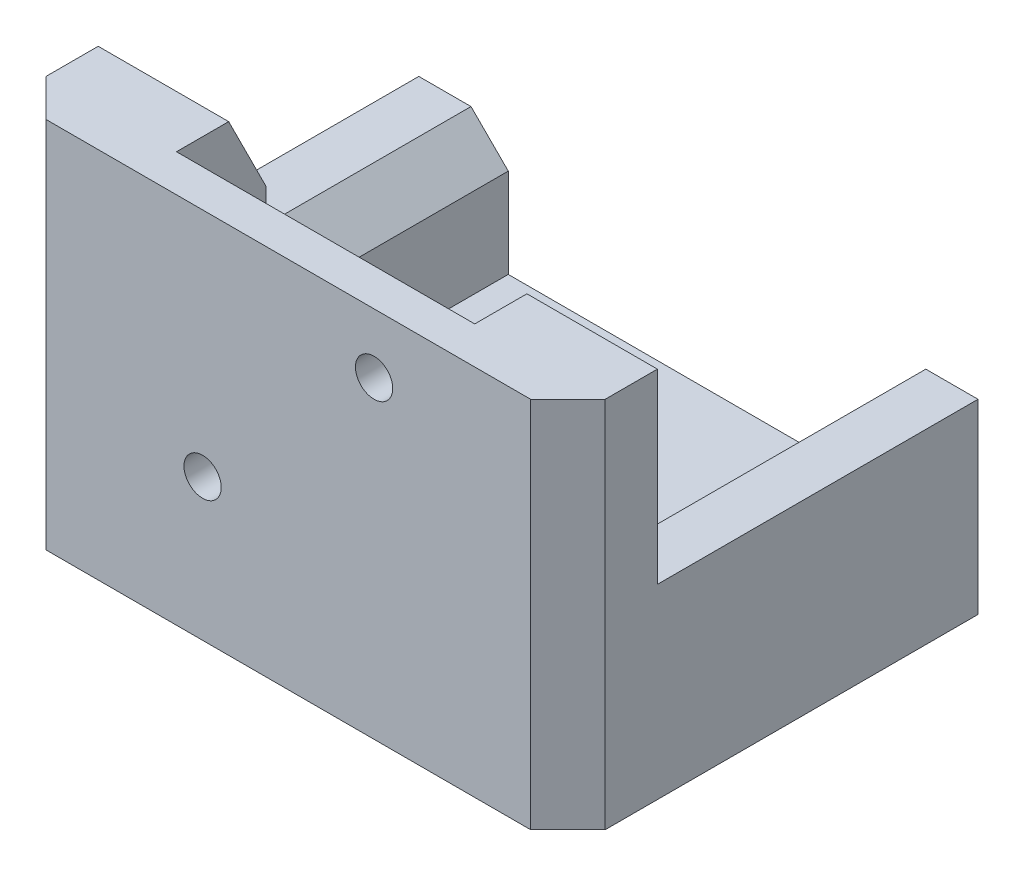
from build123d import *
from OCP.BRepFilletAPI import BRepFilletAPI_MakeChamfer

# Parameters (mm, degrees)
SKETCH1_W           = 75
SKETCH1_H           = 17
BOSS_EXTRUDE1_DEPTH = 50
SKETCH2_W           = 12
SKETCH2_H           = 25
BOSS_EXTRUDE2_DEPTH = 38
SKETCH3_W           = 75
SKETCH3_H           = 55
BOSS_EXTRUDE3_DEPTH = 8
SKETCH4_R           = 2.5
CUT_EXTRUDE1_DEPTH  = 10
SKETCH5_W           = 40
SKETCH5_H           = 42
CUT_EXTRUDE2_DEPTH  = 12
CUT_EXTRUDE3_DEPTH  = 104.07764064
CHAMFER1_SIZE       = 5
CHAMFER3_SIZE       = 5
CHAMFER3_SIZE_2     = 10
CHAMFER4_SIZE       = 5
CHAMFER4_SIZE2      = 10


with BuildPart() as part:
    # Sketch1 → Boss-Extrude1 (new body)
    with BuildSketch(Plane(origin=(0, 0, 0), x_dir=(1, 0, 0), z_dir=(0, 1, 0))):
        with Locations((37.5, 8.5)):
            Rectangle(SKETCH1_W, SKETCH1_H)
    extrude(amount=BOSS_EXTRUDE1_DEPTH)

    # Sketch2 → Boss-Extrude2 (add)
    with BuildSketch(Plane(origin=(0, 0, -17), x_dir=(-1, 0, 0), z_dir=(0, 0, -1))):
        with Locations((-69, 12.5)):
            Rectangle(SKETCH2_W, SKETCH2_H)
        with Locations((-6, 12.5)):
            Rectangle(SKETCH2_W, SKETCH2_H)
    extrude(amount=BOSS_EXTRUDE2_DEPTH)

    # Sketch3 → Boss-Extrude3 (add)
    with BuildSketch(Plane.XZ):
        with Locations((37.5, -27.5)):
            Rectangle(SKETCH3_W, SKETCH3_H)
    extrude(amount=-BOSS_EXTRUDE3_DEPTH)

    # Sketch4 → Cut-Extrude1 (cut)
    with BuildSketch(Plane(origin=(0, 0, 0), x_dir=(-1, 0, 0), z_dir=(0, -1, 0))):
        with Locations(Location((-6.5, 8, 0), (0, 0, 90))):
            Circle(SKETCH4_R)
        with Locations(Location((-68.5, 8, 0), (0, 0, 90))):
            Circle(SKETCH4_R)
        with Locations(Location((-6.5, 42, 0), (0, 0, 90))):
            Circle(SKETCH4_R)
        with Locations(Location((-68.5, 42, 0), (0, 0, 90))):
            Circle(SKETCH4_R)
    extrude(amount=-CUT_EXTRUDE1_DEPTH, mode=Mode.SUBTRACT)

    # Sketch5 → Cut-Extrude2 (cut)
    with BuildSketch(Plane(origin=(0, 0, -17), x_dir=(-1, 0, 0), z_dir=(0, 0, -1))):
        with Locations((-37.5, 29)):
            Rectangle(SKETCH5_W, SKETCH5_H)
    extrude(amount=-CUT_EXTRUDE2_DEPTH, mode=Mode.SUBTRACT)

    # Sketch6 → Cut-Extrude3 (cut, through all)
    with BuildSketch(Plane(origin=(0, 0, -5), x_dir=(-1, 0, 0), z_dir=(0, 0, -1))):
        with BuildLine():
            Line((-49, 39.5), (-49, 42))
            Line((-49, 42), (-46.5, 42))
            ThreePointArc((-46.5, 42), (-50.767766953, 43.767766953), (-49, 39.5))
        make_face()
        with BuildLine():
            Line((-46.5, 42), (-49, 42))
            Line((-49, 42), (-49, 39.5))
            ThreePointArc((-49, 39.5), (-47.232233047, 40.232233047), (-46.5, 42))
        make_face()
        with BuildLine():
            ThreePointArc((-23.5, 19), (-24.232233047, 20.767766953), (-26, 21.5))
            Line((-26, 21.5), (-26, 19))
            Line((-26, 19), (-28.5, 19))
            ThreePointArc((-28.5, 19), (-26, 16.5), (-23.5, 19))
        make_face()
        with BuildLine():
            Line((-26, 19), (-26, 21.5))
            ThreePointArc((-26, 21.5), (-27.767766953, 20.767766953), (-28.5, 19))
            Line((-28.5, 19), (-26, 19))
        make_face()
    extrude(amount=-CUT_EXTRUDE3_DEPTH, mode=Mode.SUBTRACT)

    # Chamfer1
    chamfer1_edges = [part.edges().sort_by_distance(p)[0] for p in [
        (63, 25, -36),
        (12, 25, -36),
        (75, 25, 0),
        (0, 25, 0),
    ]]
    chamfer(chamfer1_edges, length=CHAMFER1_SIZE)

    # Chamfer3
    chamfer3_edges_1 = [part.edges().sort_by_distance(p)[0] for p in [
        (0, 37.5, -17),
    ]]
    chamfer3_side_1 = [part.faces().sort_by_distance(p)[0] for p in [
        (0, 37.5, -16.9),
    ]]
    chamfer3_edges_2 = [part.edges().sort_by_distance(p)[0] for p in [
        (8.75, 50, -17),
    ]]
    chamfer3_side_2 = [part.faces().sort_by_distance(p)[0] for p in [
        (8.75, 50, -16.9),
    ]]
    chamfer3 = BRepFilletAPI_MakeChamfer(part.part.solid().wrapped)
    for e in chamfer3_edges_1:
        chamfer3.Add(CHAMFER3_SIZE - 0.0001, CHAMFER3_SIZE_2 - 0.0001, e.wrapped, chamfer3_side_1[0].wrapped)
    for e in chamfer3_edges_2:
        chamfer3.Add(CHAMFER3_SIZE - 0.0001, CHAMFER3_SIZE_2 - 0.0001, e.wrapped, chamfer3_side_2[0].wrapped)
    add(Compound.cast(chamfer3.Shape()), mode=Mode.REPLACE)  # a hair under: the kernel refuses the full size

    # Chamfer4: one chamfer whose edges measure the first distance from different faces: ONE call of the kernel's chamfer builder (chamfer() names one face for all edges)
    chamfer4_edges_1 = [part.edges().sort_by_distance(p)[0] for p in [
        (66.25, 50, -17),
    ]]
    chamfer4_side_1 = [part.faces().sort_by_distance(p)[0] for p in [
        (0.769025357, 50, -8.50005),
    ]]
    chamfer4_edges_2 = [part.edges().sort_by_distance(p)[0] for p in [
        (75, 37.5, -17),
    ]]
    chamfer4_side_2 = [part.faces().sort_by_distance(p)[0] for p in [
        (75, 17.338709677, -26.322580645),
    ]]
    chamfer4 = BRepFilletAPI_MakeChamfer(part.part.solid().wrapped)
    for e in chamfer4_edges_1:
        chamfer4.Add(CHAMFER4_SIZE, CHAMFER4_SIZE2, e.wrapped, chamfer4_side_1[0].wrapped)  # the first distance lies on this face
    for e in chamfer4_edges_2:
        chamfer4.Add(CHAMFER4_SIZE, CHAMFER4_SIZE2, e.wrapped, chamfer4_side_2[0].wrapped)  # the first distance lies on this face
    add(Compound.cast(chamfer4.Shape()), mode=Mode.REPLACE)


solid = part.part
